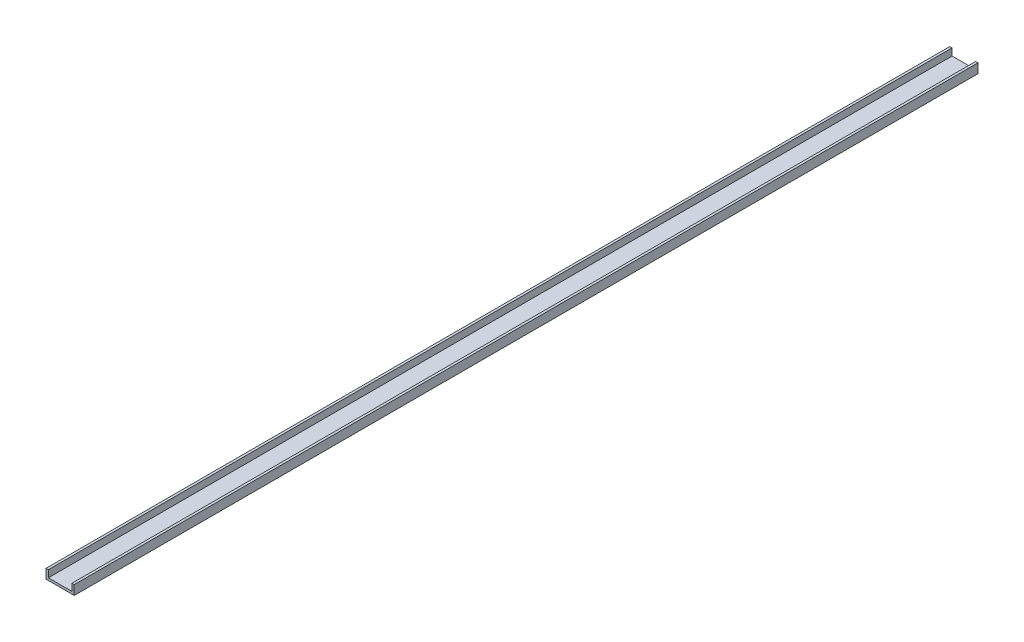
from build123d import *

# Parameters (mm, degrees)
EXTRUDE_F_DEPTH = 1219.2


with BuildPart() as part:
    # Sketch1 → Extrude f (new body)
    with BuildSketch(Plane.XY):
        Polygon((3.175, 3.175), (3.175, 12.7), (0, 12.7), (0, 0), (38.1, 0), (38.1, 12.7), (34.925, 12.7), (34.925, 3.175), align=None)
    extrude(amount=EXTRUDE_F_DEPTH)


solid = part.part
